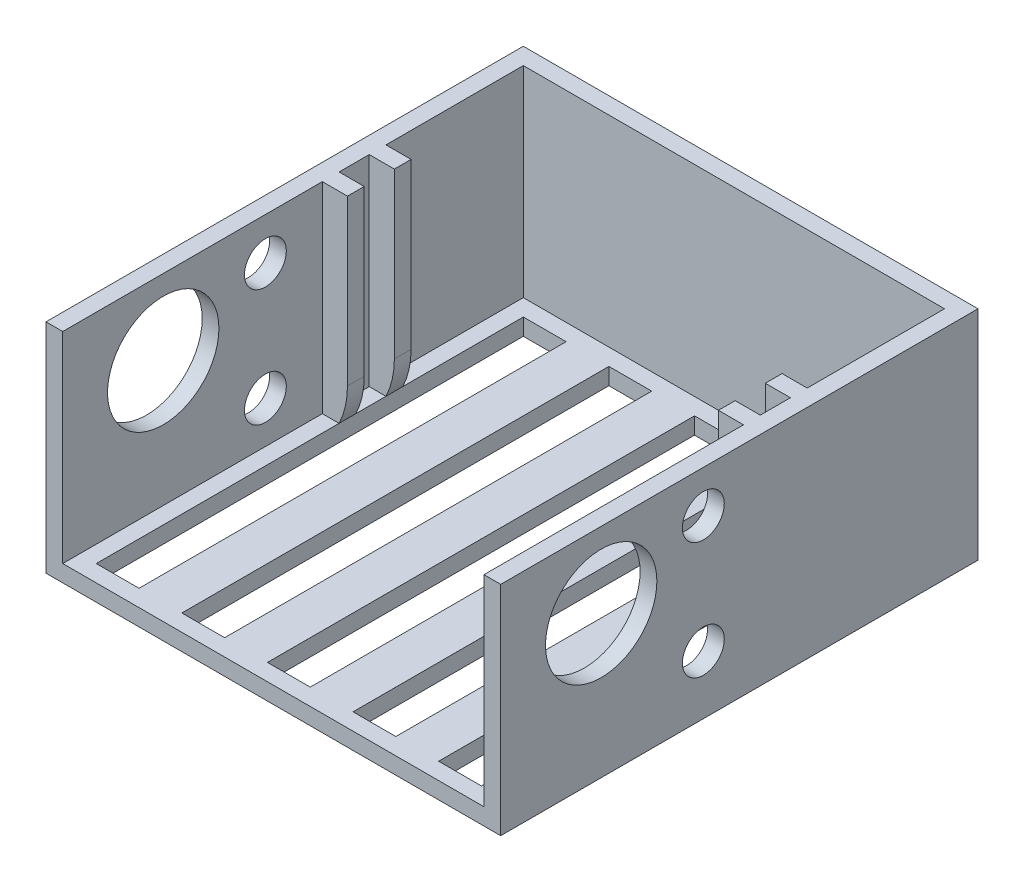
from build123d import *

# Parameters (mm, degrees)
CROQUIS1_W                 = 54.3
CROQUIS1_H                 = 59
CROQUIS1_W_2               = 50.3
CROQUIS1_H_2               = 55
SALIENTE_EXTRUIR1_DEPTH    = 24
CROQUIS2_W                 = 54.3
CROQUIS2_H                 = 59
SALIENTE_EXTRUIR2_DEPTH    = 2
CORTAR_EXTRUIR4_DEPTH      = 54.3
CORTAR_EXTRUIR5_REACH      = 81.601
CROQUIS7_W                 = 5.111111111
CROQUIS7_H                 = 51
CROQUIS7_W_2               = 5.111111112
CORTAR_EXTRUIR6_DEPTH      = 66.864425147
CORTAR_EXTRUIR6_DEPTH_BACK = 66.864425147
CROQUIS8_R                 = 6.65
CORTAR_EXTRUIR7_DEPTH      = 66.864425147
CORTAR_EXTRUIR7_DEPTH_BACK = 66.864425147
CROQUIS9_R                 = 2.5
CROQUIS10_W                = 3
CROQUIS10_H                = 2
SALIENTE_EXTRUIR3_DEPTH    = 24
REDONDEO1_R                = 10


with BuildPart() as part:
    # Croquis1 → Saliente-Extruir1 (new body)
    with BuildSketch(Plane(origin=(0, 0, 0), x_dir=(1, 0, 0), z_dir=(0, 1, 0))):
        with Locations((-25.15, -27.5)):
            Rectangle(CROQUIS1_W, CROQUIS1_H)
        with Locations((-25.15, -27.5)):
            Rectangle(CROQUIS1_W_2, CROQUIS1_H_2, mode=Mode.SUBTRACT)
    extrude(amount=SALIENTE_EXTRUIR1_DEPTH)

    # Croquis2 → Saliente-Extruir2 (add)
    with BuildSketch(Plane.XZ):
        with Locations((-25.15, 27.5)):
            Rectangle(CROQUIS2_W, CROQUIS2_H)
    extrude(amount=SALIENTE_EXTRUIR2_DEPTH)

    # Croquis6 → Cortar-Extruir4 (cut)
    with BuildSketch(Plane.ZY.offset(52.3)):
        Polygon((55, 24), (55, 0), (55, -2), (57, -2), (57, 24), align=None)
    extrude(amount=-CORTAR_EXTRUIR4_DEPTH, mode=Mode.SUBTRACT)

    # Croquis7 → Cortar-Extruir5 (cut, up to next)
    with BuildSketch(Plane(origin=(0, 0, 0), x_dir=(1, 0, 0), z_dir=(0, 1, 0)), mode=Mode.PRIVATE) as cortar_extruir5_sk1:
        with Locations((-45.744444445, -27.5)):
            Rectangle(CROQUIS7_W, CROQUIS7_H)
    cortar_extruir5_tool1 = extrude(cortar_extruir5_sk1.sketch, amount=-CORTAR_EXTRUIR5_REACH, mode=Mode.PRIVATE) & part.part
    # Croquis7 → Cortar-Extruir5 (cut, up to next)
    with BuildSketch(Plane(origin=(0, 0, 0), x_dir=(1, 0, 0), z_dir=(0, 1, 0)), mode=Mode.PRIVATE) as cortar_extruir5_sk2:
        with Locations((-35.522222223, -27.5)):
            Rectangle(CROQUIS7_W, CROQUIS7_H)
    cortar_extruir5_tool2 = extrude(cortar_extruir5_sk2.sketch, amount=-CORTAR_EXTRUIR5_REACH, mode=Mode.PRIVATE) & part.part
    # Croquis7 → Cortar-Extruir5 (cut, up to next)
    with BuildSketch(Plane(origin=(0, 0, 0), x_dir=(1, 0, 0), z_dir=(0, 1, 0)), mode=Mode.PRIVATE) as cortar_extruir5_sk3:
        with Locations((-25.3, -27.5)):
            Rectangle(CROQUIS7_W_2, CROQUIS7_H)
    cortar_extruir5_tool3 = extrude(cortar_extruir5_sk3.sketch, amount=-CORTAR_EXTRUIR5_REACH, mode=Mode.PRIVATE) & part.part
    # Croquis7 → Cortar-Extruir5 (cut, up to next)
    with BuildSketch(Plane(origin=(0, 0, 0), x_dir=(1, 0, 0), z_dir=(0, 1, 0)), mode=Mode.PRIVATE) as cortar_extruir5_sk4:
        with Locations((-15.077777777, -27.5)):
            Rectangle(CROQUIS7_W, CROQUIS7_H)
    cortar_extruir5_tool4 = extrude(cortar_extruir5_sk4.sketch, amount=-CORTAR_EXTRUIR5_REACH, mode=Mode.PRIVATE) & part.part
    # Croquis7 → Cortar-Extruir5 (cut, up to next)
    with BuildSketch(Plane(origin=(0, 0, 0), x_dir=(1, 0, 0), z_dir=(0, 1, 0)), mode=Mode.PRIVATE) as cortar_extruir5_sk5:
        with Locations((-4.855555556, -27.5)):
            Rectangle(CROQUIS7_W, CROQUIS7_H)
    cortar_extruir5_tool5 = extrude(cortar_extruir5_sk5.sketch, amount=-CORTAR_EXTRUIR5_REACH, mode=Mode.PRIVATE) & part.part
    add(cortar_extruir5_tool1.solids().sort_by_distance((-45.744444, 0, 27.5))[0], mode=Mode.SUBTRACT)
    add(cortar_extruir5_tool2.solids().sort_by_distance((-35.522222, 0, 27.5))[0], mode=Mode.SUBTRACT)
    add(cortar_extruir5_tool3.solids().sort_by_distance((-25.3, 0, 27.5))[0], mode=Mode.SUBTRACT)
    add(cortar_extruir5_tool4.solids().sort_by_distance((-15.077778, 0, 27.5))[0], mode=Mode.SUBTRACT)
    add(cortar_extruir5_tool5.solids().sort_by_distance((-4.855556, 0, 27.5))[0], mode=Mode.SUBTRACT)

    # Croquis8 → Cortar-Extruir6 (cut, two sides: drawn at the far end of the back side and taken through both)
    with BuildSketch(Plane(origin=(-25.15, 0, 0), x_dir=(0, 0, -1), z_dir=(1, 0, 0)).offset(-CORTAR_EXTRUIR6_DEPTH_BACK)):
        with Locations((-43, 15)):
            Circle(CROQUIS8_R)
    extrude(amount=CORTAR_EXTRUIR6_DEPTH + CORTAR_EXTRUIR6_DEPTH_BACK, mode=Mode.SUBTRACT)

    # Croquis9 → Cortar-Extruir7 (cut, two sides: drawn at the far end of the back side and taken through both)
    with BuildSketch(Plane(origin=(-25.15, 0, 0), x_dir=(0, 0, -1), z_dir=(1, 0, 0)).offset(-CORTAR_EXTRUIR7_DEPTH_BACK)):
        with Locations((-30.8, 19)):
            Circle(CROQUIS9_R)
        with Locations((-30.8, 5)):
            Circle(CROQUIS9_R)
    extrude(amount=CORTAR_EXTRUIR7_DEPTH + CORTAR_EXTRUIR7_DEPTH_BACK, mode=Mode.SUBTRACT)

    # Croquis10 → Saliente-Extruir3 (add)
    with BuildSketch(Plane(origin=(0, 24, 0), x_dir=(1, 0, 0), z_dir=(0, 1, 0))):
        with Locations((-48.8, -17.4)):
            Rectangle(CROQUIS10_W, CROQUIS10_H)
        with Locations((-48.8, -23)):
            Rectangle(CROQUIS10_W, CROQUIS10_H)
        with Locations((-1.5, -23)):
            Rectangle(CROQUIS10_W, CROQUIS10_H)
        with Locations((-1.5, -17.4)):
            Rectangle(CROQUIS10_W, CROQUIS10_H)
    extrude(amount=-SALIENTE_EXTRUIR3_DEPTH)

    # Redondeo1
    # the kernel refuses this fillet: 10 mm, written as the material it takes off along each edge
    with BuildSketch(Plane(origin=(-3, 0, 7.211012025), x_dir=(0, 1, 0), z_dir=(0, 0, 1)), Plane(origin=(-3, 0, 12.811012025), x_dir=(0, 1, 0), z_dir=(0, 0, 1))) as redondeo1_piece_1:
        with BuildLine():
            CenterArc((3.67559519, -10), REDONDEO1_R, 90, 21.565185015)
            Line((0, -0.7), (-0.073511904, -0.514))
            ThreePointArc((-0.073511904, -0.514), (-0.2, -0.35), (-0.2, 0))
            Line((-0.2, 0), (0, 0.2))
            Line((0, 0.2), (3.67559519, 0.2))
            Line((3.67559519, 0.2), (3.67559519, 0))
        make_face()
    extrude(amount=20.377975949, mode=Mode.SUBTRACT)
    with BuildSketch(Plane(origin=(-47.3, 0, 29.297247359), x_dir=(0, 1, 0), z_dir=(0, 0, -1)), Plane(origin=(-47.3, 0, 34.897247359), x_dir=(0, 1, 0), z_dir=(0, 0, -1))) as redondeo1_piece_2:
        with BuildLine():
            CenterArc((4.358898944, -10), REDONDEO1_R, 90, 25.841932763)
            Line((0, -1), (-0.087177979, -0.82))
            ThreePointArc((-0.087177979, -0.82), (-0.2, -0.5), (-0.2, 0))
            Line((-0.2, 0), (0, 0.2))
            Line((0, 0.2), (4.358898944, 0.2))
            Line((4.358898944, 0.2), (4.358898944, 0))
        make_face()
    extrude(amount=23.794494718, mode=Mode.SUBTRACT)


solid = part.part
